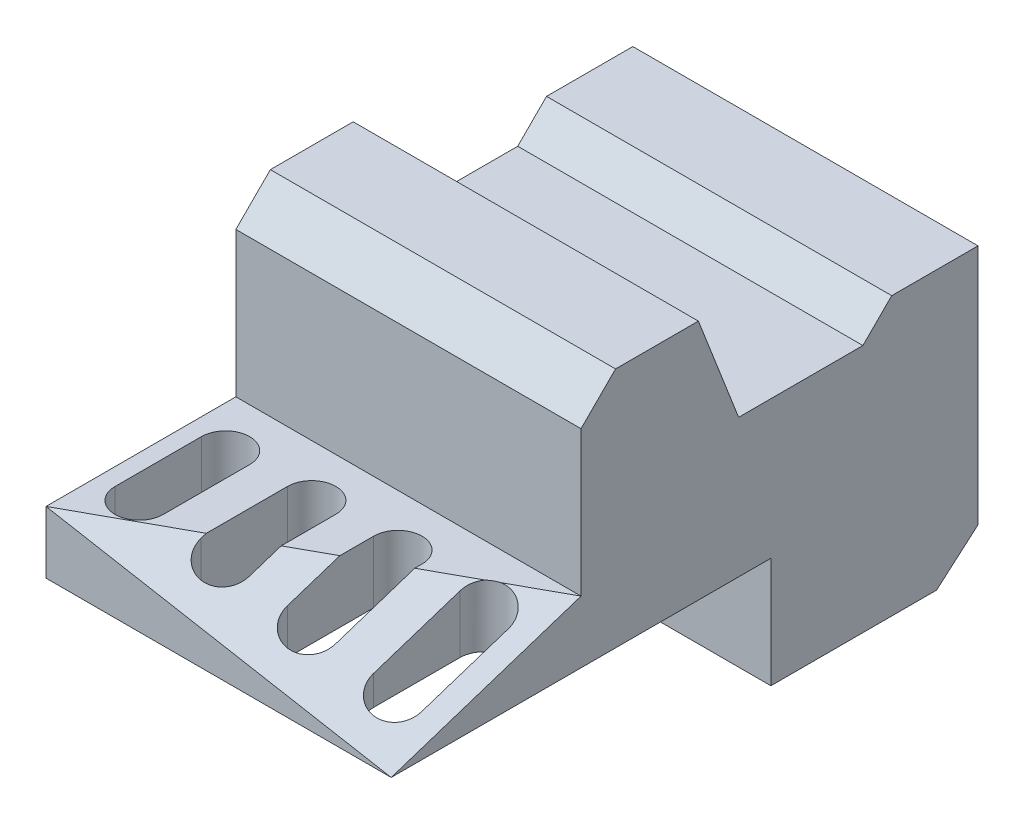
from build123d import *

# Parameters (mm, degrees)
RESSALTO_EXTRUS_O1_DEPTH = 100
CORTE_EXTRUS_O1_DEPTH    = 204.970201133
CORTE_EXTRUS_O4_DEPTH    = 87
CORTE_EXTRUS_O6_DEPTH    = 20


with BuildPart() as part:
    # Esboço3 → Ressalto-extrusão1 (new body)
    with BuildSketch(Plane(origin=(0, 0, 0), x_dir=(0, 0, -1), z_dir=(1, 0, 0))):
        Polygon((0, 0), (0, -70), (-12, -80.38), (-60, -80.38), (-60, -48.378489886), (-170, -48.378489886), (-170, -30.378489886), (-115, -30.378489886), (-115, 11.621510114), (-105.001510114, 21.62), (-81.001510114, 21.62), (-69.343860018, -8.343860018), (-33.343860018, -8.343860018), (-25, 0), align=None)
    extrude(amount=RESSALTO_EXTRUS_O1_DEPTH)

    # Esboço5 → Corte-extrusão1 (cut, through all)
    with BuildSketch(Plane(origin=(0, -30.378489886, 0), x_dir=(1, 0, 0), z_dir=(0, 1, 0))):
        with BuildLine():
            Line((5, -155.02), (5, -129.98))
            ThreePointArc((5, -129.98), (12, -122.98), (19, -129.98))
            Line((19, -129.98), (19, -155.02))
            ThreePointArc((19, -155.02), (12, -162.02), (5, -155.02))
        make_face()
        with BuildLine():
            Line((29.96, -155.02), (29.96, -129.98))
            ThreePointArc((29.96, -129.98), (36.96, -122.98), (43.96, -129.98))
            Line((43.96, -129.98), (43.96, -155.02))
            ThreePointArc((43.96, -155.02), (36.96, -162.02), (29.96, -155.02))
        make_face()
        with BuildLine():
            Line((54.92, -155.02), (54.92, -129.98))
            ThreePointArc((54.92, -129.98), (61.92, -122.98), (68.92, -129.98))
            Line((68.92, -129.98), (68.92, -155.02))
            ThreePointArc((68.92, -155.02), (61.92, -162.02), (54.92, -155.02))
        make_face()
        with BuildLine():
            Line((79.88, -155.02), (79.88, -129.98))
            ThreePointArc((79.88, -129.98), (86.88, -122.98), (93.88, -129.98))
            Line((93.88, -129.98), (93.88, -155.02))
            ThreePointArc((93.88, -155.02), (86.88, -162.02), (79.88, -155.02))
        make_face()
    extrude(amount=-CORTE_EXTRUS_O1_DEPTH, mode=Mode.SUBTRACT)

    # Esboço6 → Corte-extrusão4 (cut)
    with BuildSketch(Plane(origin=(3.989809214, 22.165606742, 7.25419857), x_dir=(0.9856808114809098, -0.16025774913447463, -0.05244799062582808), z_dir=(0.16862187840946133, 0.9367882133858959, 0.30658523347174793))):
        Polygon((-4.047769995, -171.016408889), (97.404950637, -176.615111976), (97.404950637, -118.744566791), align=None)
    extrude(amount=CORTE_EXTRUS_O4_DEPTH, mode=Mode.SUBTRACT)

    # Esboço9 → Corte-extrusão6 (cut)
    with BuildSketch(Plane.ZY):
        Polygon((105, 11.62), (87.841109365, 11.62), (76.183459269, -18.343860018), (29.781857804, -18.343860018), (21.437997786, -10), (10, -10), (10, -65.427954016), (15.724908652, -70.38), (50, -70.38), (50, -38.378489886), (105, -38.378489886), align=None)
    extrude(amount=-CORTE_EXTRUS_O6_DEPTH, mode=Mode.SUBTRACT)


solid = part.part
